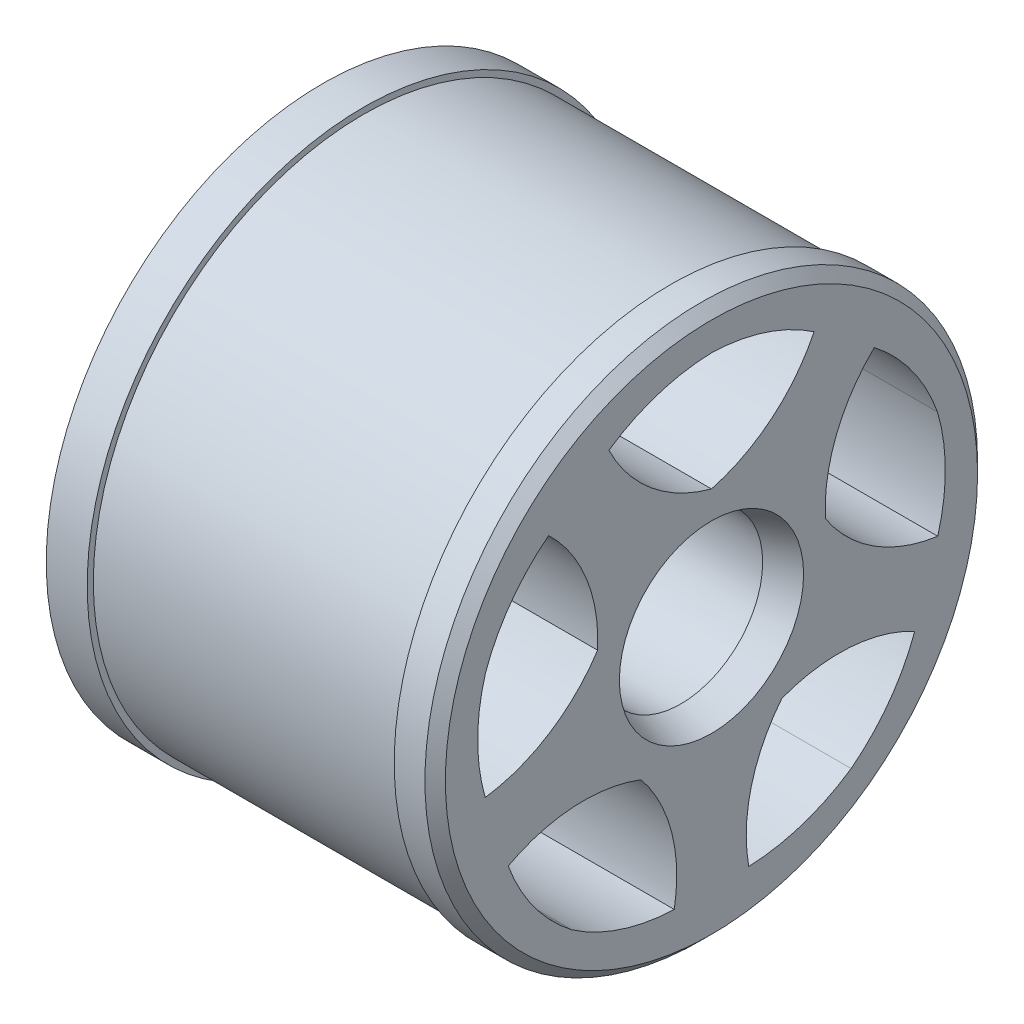
from build123d import *

# Parameters (mm, degrees)
SKETCH1_R           = 13.5
SKETCH1_R_2         = 4
BOSS_EXTRUDE1_DEPTH = 9.5
CUT_EXTRUDE1_DEPTH  = 22.324868112
CIRPATTERN1_COUNT   = 5
CHAMFER1_SIZE       = 0.5
SKETCH4_R           = 13.5
SKETCH4_R_2         = 13.2
CUT_EXTRUDE3_DEPTH  = 7.5
CHAMFER2_SIZE       = 0.5
CHAMFER2_SIZE2      = 1.5


with BuildPart() as part:
    # Sketch1 → Boss-Extrude1 (new, symmetric)
    with BuildSketch(Plane(origin=(0, 0, 0), x_dir=(0, 0, -1), z_dir=(1, 0, 0))):
        Circle(SKETCH1_R)
        Circle(SKETCH1_R_2, mode=Mode.SUBTRACT)
    extrude(amount=BOSS_EXTRUDE1_DEPTH, both=True)

    # Sketch2 → Cut-Extrude1 (cut, symmetric)
    with BuildSketch(Plane(origin=(0, 0, 0), x_dir=(0, 0, -1), z_dir=(1, 0, 0))):
        with BuildLine():
            ThreePointArc((0, 5.849695328), (-2.956289657, 7.377375059), (-5.012219469, 9.99397715))
            ThreePointArc((-5.012219469, 9.99397715), (-2.621563936, 11.159720287), (0, 11.6087119))
            ThreePointArc((0, 11.6087119), (2.621563936, 11.159720287), (5.012219469, 9.99397715))
            ThreePointArc((5.012219469, 9.99397715), (2.956289657, 7.377375059), (0, 5.849695328))
        make_face()
    cut_extrude1 = extrude(amount=CUT_EXTRUDE1_DEPTH, both=True, mode=Mode.SUBTRACT)

    # CirPattern1: Cut-Extrude1 ×5 about axis
    cirpattern1_axis = Axis((9.5, 0, 0), (-1, 0, 0))
    for i in range(1, CIRPATTERN1_COUNT):
        add(cut_extrude1.rotate(cirpattern1_axis, i * 360 / CIRPATTERN1_COUNT), mode=Mode.SUBTRACT)

    # Chamfer1
    chamfer1_edges = [part.edges().sort_by_distance(p)[0] for p in [
        (9.5, 0, 13.5),
    ]]
    chamfer(chamfer1_edges, length=CHAMFER1_SIZE)

    # Sketch4 → Cut-Extrude3 (cut, symmetric)
    with BuildSketch(Plane(origin=(0, 0, 0), x_dir=(0, 0, -1), z_dir=(1, 0, 0))):
        Circle(SKETCH4_R)
        Circle(SKETCH4_R_2, mode=Mode.SUBTRACT)
    extrude(amount=CUT_EXTRUDE3_DEPTH, both=True, mode=Mode.SUBTRACT)

    # Chamfer2
    chamfer2_edges = [part.edges().sort_by_distance(p)[0] for p in [
        (9.5, 0, 4),
    ]]
    chamfer2_side = [part.faces().sort_by_distance(p)[0] for p in [
        (9.5, 0, 12.632304474),
    ]]
    chamfer(chamfer2_edges, length=CHAMFER2_SIZE, length2=CHAMFER2_SIZE2, reference=chamfer2_side[0])


solid = part.part
